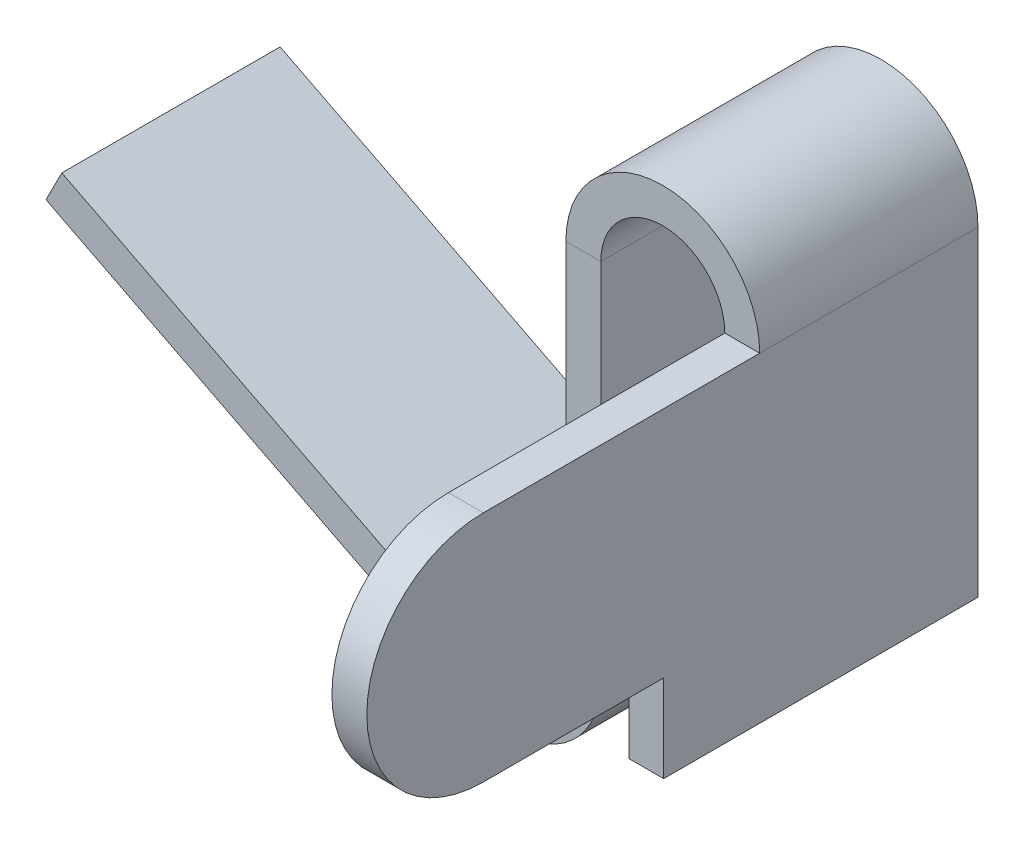
from build123d import *

# Parameters (mm, degrees)
BASE_FLANGE1_DEPTH  = 2.5
SKETCH6_W           = 0.4
SKETCH6_H           = 3.67
BOSS_EXTRUDE1_DEPTH = 4.5
SKETCH7_W           = 3.4
SKETCH7_H           = 1
CUT_EXTRUDE1_DEPTH  = 12.266991905
FILLET1_RADIUS      = 1.335
FILLET1_LENGTH      = 0.4


# Sheet-metal steps are written as plain solids
with BuildPart() as part:
    # Sketch1 → Base-Flange1 (new body)
    with BuildSketch(Plane.XY):
        with BuildLine():
            Line((0.71, -1.835), (0.71, 1.835))
            ThreePointArc((0.71, 1.835), (0, 2.545), (-0.71, 1.835))
            Line((-0.71, 1.835), (-0.71, -2.335))
            ThreePointArc((-0.71, -2.335), (-1.187501435, -3.187640164), (-2.1639905, -3.226006524))
            Line((-2.1639905, -3.226006524), (-7.064526383, -0.729058776))
            Line((-7.064526383, -0.729058776), (-6.882930183, -0.372656166))
            Line((-6.882930183, -0.372656166), (-1.9823943, -2.869603915))
            ThreePointArc((-1.9823943, -2.869603915), (-1.396500861, -2.846584099), (-1.11, -2.335))
            Line((-1.11, -2.335), (-1.11, 1.835))
            ThreePointArc((-1.11, 1.835), (0, 2.945), (1.11, 1.835))
            Line((1.11, 1.835), (1.11, -1.835))
            Line((1.11, -1.835), (0.71, -1.835))
        make_face()
    extrude(amount=BASE_FLANGE1_DEPTH)

    # Sketch6 → Boss-Extrude1 (add)
    with BuildSketch(Plane.XY.offset(2.5)):
        with Locations((0.91, 0)):
            Rectangle(SKETCH6_W, SKETCH6_H)
    extrude(amount=BOSS_EXTRUDE1_DEPTH)

    # Sketch7 → Cut-Extrude1 (cut, through all)
    with BuildSketch(Plane(origin=(1.11, 0, 0), x_dir=(0, 0, -1), z_dir=(1, 0, 0))):
        with Locations((-5.3, -1.335)):
            Rectangle(SKETCH7_W, SKETCH7_H)
    extrude(amount=-CUT_EXTRUDE1_DEPTH, mode=Mode.SUBTRACT)

    # Fillet1: full round fillet: the end face becomes a half cylinder, R = half its width
    fillet1_face = Plane((0.91, 0.5, 7), x_dir=(-1, 0, 0), z_dir=(0, 0, 1))  # on the end face: x along it, z out of the body
    fillet1_slab = fillet1_face.offset(-FILLET1_RADIUS / 2) * Box(FILLET1_LENGTH, 2 * FILLET1_RADIUS, FILLET1_RADIUS, mode=Mode.PRIVATE)  # the body's end, R deep
    fillet1_round = Plane((0.91, 0.5, 5.665), x_dir=(0, 0, 1), z_dir=(-1, 0, 0)) * Cylinder(FILLET1_RADIUS, FILLET1_LENGTH, mode=Mode.PRIVATE)  # its axis R under the face
    add(fillet1_slab - fillet1_round, mode=Mode.SUBTRACT)


solid = part.part
